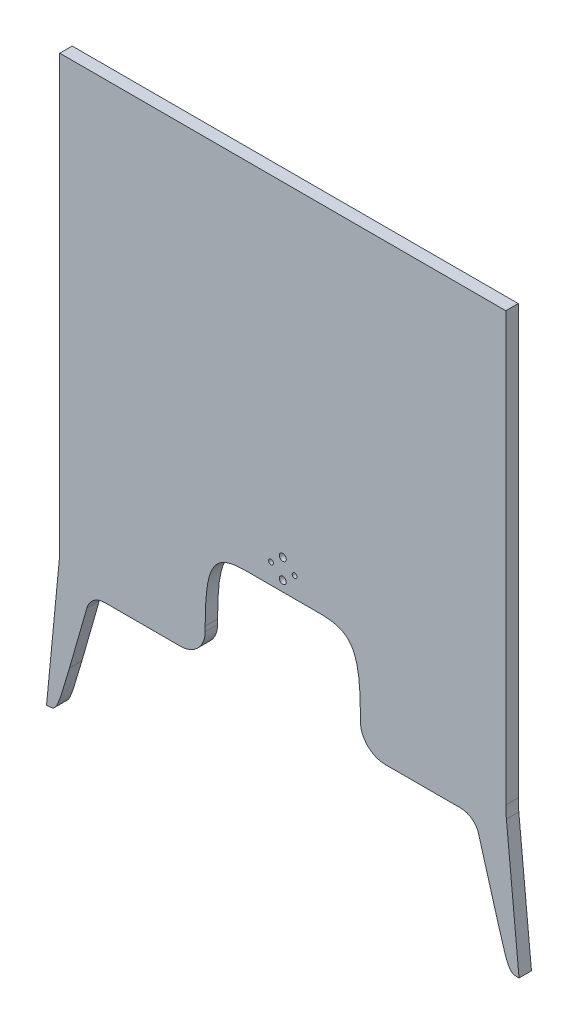
from build123d import *

# Parameters (mm, degrees)
BOSS_EXTRUDE1_DEPTH     = 12.7
FILLET2_SIZE            = 41.275
FILLET2_SIZE_2          = 69.85
FILLET3_R               = 25.4
FILLET4_R               = 19.05
FILLET6_R               = 127
CUT_EXTRUDE1_REACH      = 634.314
SKETCH3_W               = 241.600142069
SKETCH3_H               = 584.2
F_8_CLEARANCE_HOLE1_D   = 4.9149
F_1_4_CLEARANCE_HOLE1_D = 7.14248


with BuildPart() as part:
    # Sketch1 → Boss-Extrude1 (new body)
    with BuildSketch(Plane.XY):
        Polygon((-228.088766336, 0), (228.088766336, 0), (228.088766336, -443.878997916), (241.600142069, -584.2), (230.934597128, -584.2), (196.338766336, -463.55), (79.375, -463.55), (79.375, -363.22), (-79.375, -363.22), (-79.375, -463.55), (-196.338766336, -463.55), (-230.934597128, -584.2), (-241.600142069, -584.2), (-228.088766336, -443.878997916), align=None)
    extrude(amount=BOSS_EXTRUDE1_DEPTH)

    # Fillet2
    # a fillet whose section is not a circle: 69.85, 41.275 mm, written as the material it adds along each edge
    with BuildSketch(Plane(origin=(-79.375, -363.22, 0), x_dir=(1, 0, 0), z_dir=(0, 0, 1))) as fillet2_piece_1:
        with BuildLine():
            Bezier((FILLET2_SIZE, 0), (0, 0), (0, -FILLET2_SIZE_2), weights=[1, 1.5, 1])
            Line((0, -FILLET2_SIZE_2), (0, 0))
            Line((0, 0), (FILLET2_SIZE, 0))
        make_face()
    extrude(amount=12.7)

    # Fillet3
    fillet3_edges = [part.edges().sort_by_distance(p)[0] for p in [
        (-79.375, -463.55, 6.35),
    ]]
    fillet(fillet3_edges, radius=FILLET3_R)

    # Fillet4
    fillet4_edges = [part.edges().sort_by_distance(p)[0] for p in [
        (-196.338766336, -463.55, 6.35),
    ]]
    fillet(fillet4_edges, radius=FILLET4_R)

    # Fillet5
    # a fillet whose section is not a circle: 50.8, 22.225 mm, written as the material it takes off along each edge
    with BuildSketch(Plane(origin=(-230.934597128, -584.2, -116.185737858), x_dir=(0.2756373558169957, 0.9612616959383199, 0), z_dir=(0, 0, 1))) as fillet5_piece_1:
        with BuildLine():
            Bezier((46.474295143, 0), (0, 0), (-2.35779901, 8.222622324), weights=[1, 2.333333333, 1])
            Line((-2.35779901, 8.222622324), (0, 0))
            Line((0, 0), (46.474295143, 0))
        make_face()
    extrude(amount=245.071475716, mode=Mode.SUBTRACT)

    # Fillet6
    # the kernel refuses this fillet: 127 mm, written as the material it adds along each edge
    with BuildSketch(Plane(origin=(-228.088766336, -443.878997916, 0), x_dir=(0, 1, 0), z_dir=(0, 0, 1))) as fillet6_piece_1:
        with BuildLine():
            CenterArc((FILLET6_R * 0.0480334444852, FILLET6_R), FILLET6_R, 264.5, 5.5)
            Line((-FILLET6_R * 0.047812308035, FILLET6_R * 0.00460380163282), (0, 0))
            Line((0, 0), (FILLET6_R * 0.0480334444852, 0))
        make_face()
    extrude(amount=12.7)

    # Sketch3 → Cut-Extrude1 (cut, up to next)
    with BuildSketch(Plane.XY.offset(12.7), mode=Mode.PRIVATE) as cut_extrude1_sk1:
        with Locations((120.800071035, -292.1)):
            Rectangle(SKETCH3_W, SKETCH3_H)
    cut_extrude1_tool1 = extrude(cut_extrude1_sk1.sketch, amount=-CUT_EXTRUDE1_REACH, mode=Mode.PRIVATE) & part.part
    add(cut_extrude1_tool1.solids().sort_by_distance((120.800071, -292.1, 12.7))[0], mode=Mode.SUBTRACT)

    # Mirror5: part across plane


with BuildPart() as part_1:
    add(part.part)
    add(part.part.mirror(Plane(origin=(0, 0, -0.35025), x_dir=(0, 0, 1), z_dir=(-1, 0, 0))))

    # #8 Clearance Hole1 (through all)
    with Locations(Plane(origin=(0, 0, 0), x_dir=(-1, 0, 0), z_dir=(0, 0, -1))):
        with Locations((12.077216058, -342.5825), (-12.077216058, -342.5825)):
            Hole(F_8_CLEARANCE_HOLE1_D / 2)

    # 1/4 Clearance Hole1 (through all)
    with Locations(Plane(origin=(0, 0, 0), x_dir=(-1, 0, 0), z_dir=(0, 0, -1))):
        with Locations((0, -352.7425), (0, -332.4225)):
            Hole(F_1_4_CLEARANCE_HOLE1_D / 2)


solid = part_1.part
